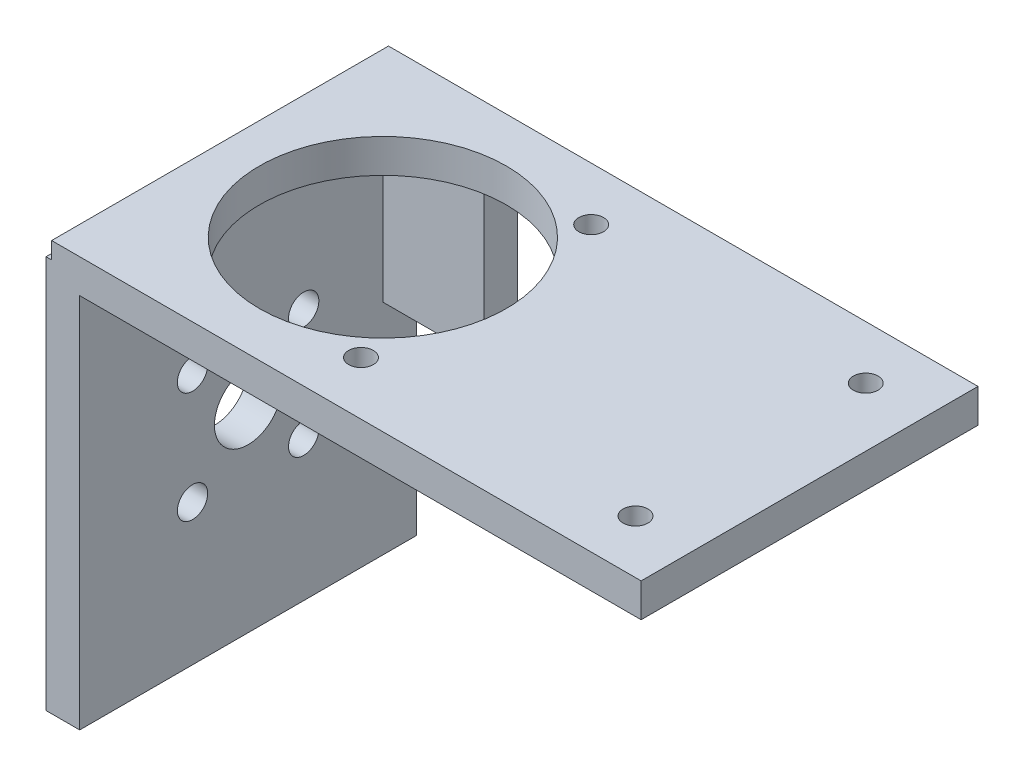
from build123d import *

# Parameters (mm, degrees)
S_BOX1_W      = 3
S_BOX1_H      = 35
BOSS_1_DEPTH  = 30
S_BOX2_W      = 52.5
S_BOX2_H      = 3
BOSS_2_DEPTH  = 30
S_BOX3_W      = 11.5
S_BOX3_H      = 16.5
BOSS_3_DEPTH  = 3
S_HOLE4_R     = 3
HOLE_4_DEPTH  = 3.2
S_HOLE5_R     = 1.35
HOLE_5_DEPTH  = 3.2
S_HOLE6_R     = 1.35
HOLE_6_DEPTH  = 3.2
S_HOLE7_R     = 1.35
HOLE_7_DEPTH  = 3.2
S_HOLE8_R     = 1.35
HOLE_8_DEPTH  = 3.2
S_HOLE9_R     = 11
HOLE_9_DEPTH  = 3.2
S_HOLE10_R    = 1.1
HOLE_10_DEPTH = 3.2
S_HOLE11_R    = 1.1
HOLE_11_DEPTH = 3.2
S_HOLE12_R    = 1.1
HOLE_12_DEPTH = 3.2
S_HOLE13_R    = 1.1
HOLE_13_DEPTH = 3.2


with BuildPart() as part:
    # S_box1 → Boss_1 (new body)
    with BuildSketch(Plane.XY.offset(-15)):
        with Locations((-13.5, 0)):
            Rectangle(S_BOX1_W, S_BOX1_H)
    extrude(amount=BOSS_1_DEPTH)

    # S_box2 → Boss_2 (add)
    with BuildSketch(Plane.XY.offset(-15)):
        with Locations((11.75, 17.5)):
            Rectangle(S_BOX2_W, S_BOX2_H)
    extrude(amount=BOSS_2_DEPTH)

    # S_box3 → Boss_3 (add)
    with BuildSketch(Plane.XY.offset(-15)):
        with Locations((-8.75, 10.25)):
            Rectangle(S_BOX3_W, S_BOX3_H)
    extrude(amount=BOSS_3_DEPTH)

    # S_hole4 → Hole_4 (cut)
    with BuildSketch(Plane(origin=(-15.1, 0, 0), x_dir=(0, 0, -1), z_dir=(1, 0, 0))):
        Circle(S_HOLE4_R)
    extrude(amount=HOLE_4_DEPTH, mode=Mode.SUBTRACT)

    # S_hole5 → Hole_5 (cut)
    with BuildSketch(Plane(origin=(-15.1, 0, 0), x_dir=(0, 0, -1), z_dir=(1, 0, 0))):
        with Locations((-4.949747468, -4.949747468)):
            Circle(S_HOLE5_R)
    extrude(amount=HOLE_5_DEPTH, mode=Mode.SUBTRACT)

    # S_hole6 → Hole_6 (cut)
    with BuildSketch(Plane(origin=(-15.1, 0, 0), x_dir=(0, 0, -1), z_dir=(1, 0, 0))):
        with Locations((-4.949747468, 4.949747468)):
            Circle(S_HOLE6_R)
    extrude(amount=HOLE_6_DEPTH, mode=Mode.SUBTRACT)

    # S_hole7 → Hole_7 (cut)
    with BuildSketch(Plane(origin=(-15.1, 0, 0), x_dir=(0, 0, -1), z_dir=(1, 0, 0))):
        with Locations((4.949747468, 4.949747468)):
            Circle(S_HOLE7_R)
    extrude(amount=HOLE_7_DEPTH, mode=Mode.SUBTRACT)

    # S_hole8 → Hole_8 (cut)
    with BuildSketch(Plane(origin=(-15.1, 0, 0), x_dir=(0, 0, -1), z_dir=(1, 0, 0))):
        with Locations((4.949747468, -4.949747468)):
            Circle(S_HOLE8_R)
    extrude(amount=HOLE_8_DEPTH, mode=Mode.SUBTRACT)

    # S_hole9 → Hole_9 (cut)
    with BuildSketch(Plane(origin=(0, 15.9, 0), x_dir=(1, 0, 0), z_dir=(0, 1, 0))):
        Circle(S_HOLE9_R)
    extrude(amount=HOLE_9_DEPTH, mode=Mode.SUBTRACT)

    # S_hole10 → Hole_10 (cut)
    with BuildSketch(Plane(origin=(0, 15.9, 0), x_dir=(1, 0, 0), z_dir=(0, 1, 0))):
        with Locations((8.3, 10.25)):
            Circle(S_HOLE10_R)
    extrude(amount=HOLE_10_DEPTH, mode=Mode.SUBTRACT)

    # S_hole11 → Hole_11 (cut)
    with BuildSketch(Plane(origin=(0, 15.9, 0), x_dir=(1, 0, 0), z_dir=(0, 1, 0))):
        with Locations((8.3, -10.25)):
            Circle(S_HOLE11_R)
    extrude(amount=HOLE_11_DEPTH, mode=Mode.SUBTRACT)

    # S_hole12 → Hole_12 (cut)
    with BuildSketch(Plane(origin=(0, 15.9, 0), x_dir=(1, 0, 0), z_dir=(0, 1, 0))):
        with Locations((32.75, 10.25)):
            Circle(S_HOLE12_R)
    extrude(amount=HOLE_12_DEPTH, mode=Mode.SUBTRACT)

    # S_hole13 → Hole_13 (cut)
    with BuildSketch(Plane(origin=(0, 15.9, 0), x_dir=(1, 0, 0), z_dir=(0, 1, 0))):
        with Locations((32.75, -10.25)):
            Circle(S_HOLE13_R)
    extrude(amount=HOLE_13_DEPTH, mode=Mode.SUBTRACT)


solid = part.part
